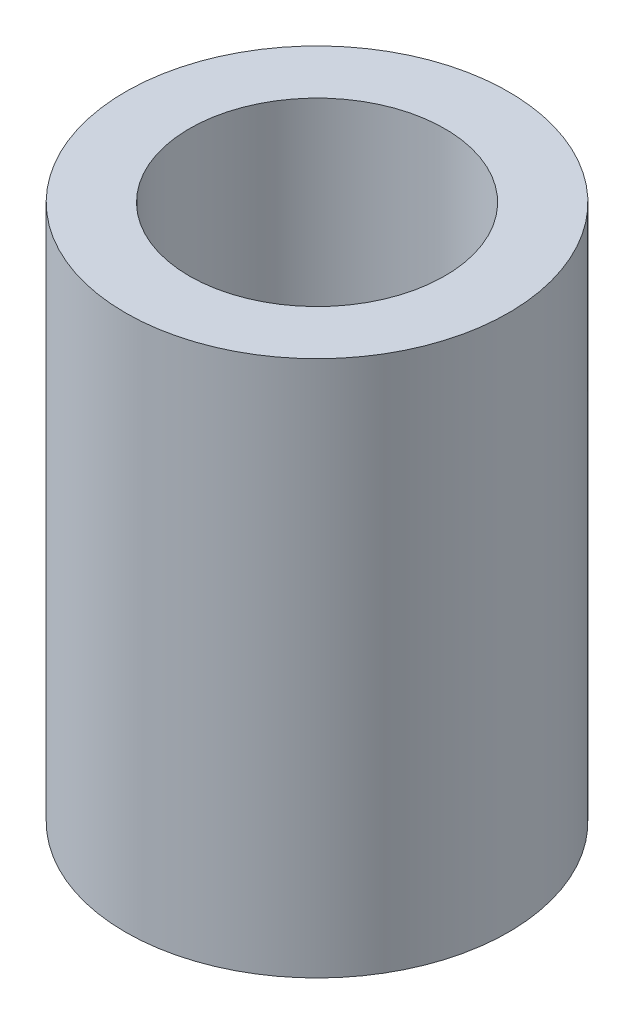
from build123d import *

# Parameters (mm, degrees)
SKETCH_1_R      = 1.5
SKETCH_1_R_2    = 1
EXTRUDE_1_DEPTH = 4.2


with BuildPart() as part:
    # Эскиз1 → Бобышка-Вытянуть1 (new body)
    with BuildSketch(Plane(origin=(0, 0, 0), x_dir=(1, 0, 0), z_dir=(0, 1, 0))):
        Circle(SKETCH_1_R)
        Circle(SKETCH_1_R_2, mode=Mode.SUBTRACT)
    extrude(amount=EXTRUDE_1_DEPTH)


solid = part.part
